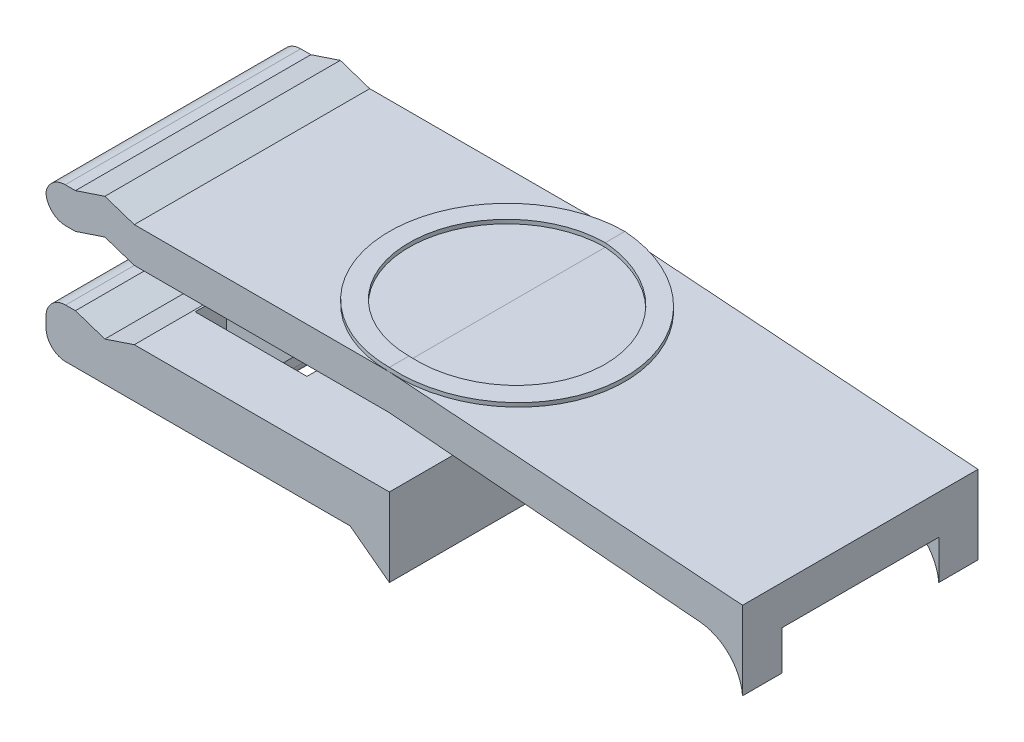
from build123d import *

# Parameters (mm, degrees)
BOSS_EXTRUDE1_DEPTH   = 12
BOSS_EXTRUDE1_2_DEPTH = 12
SKETCH2_W             = 5.7
SKETCH2_H             = 6
CUT_EXTRUDE1_DEPTH    = 3
BOSS_EXTRUDE2_DEPTH   = 6
BOSS_EXTRUDE3_START   = -6
BOSS_EXTRUDE3_DEPTH   = 2.5
FILLET7_R             = 1
FILLET8_R             = 1
FILLET10_R            = 1
FILLET11_R            = 1
BOSS_EXTRUDE4_DEPTH   = 2
BOSS_EXTRUDE5_START   = -10
BOSS_EXTRUDE5_DEPTH   = 2
FILLET12_R            = 0.5
BOSS_EXTRUDE7_REACH   = 45.42
BOSS_EXTRUDE7_START   = 5.5
SKETCH6_R             = 6
SKETCH6_R_2           = 5
CUT_EXTRUDE3_DEPTH    = 38.919520039


with BuildPart() as part:
    # Sketch1 → Boss-Extrude1 (new body)
    with BuildSketch(Plane.XY):
        Polygon((0, 4), (-18, 5.3), (-31, 5.3), (-32.5, 5.8), (-34, 5.3), (-35.5, 5.3), (-35.5, 3.5), (-34, 3.5), (-32.5, 4), (-31, 3.5), (-18, 3.5), (0, 2), align=None)
    extrude(amount=BOSS_EXTRUDE1_DEPTH)

    # Sketch4 → Boss-Extrude3 (add, symmetric)
    with BuildSketch(Plane.XY.offset(12).offset(BOSS_EXTRUDE3_START)):
        with BuildLine():
            Line((-28.4, -2), (-26.4, 0))
            Line((-26.4, 0), (-26.4, 0.4))
            Line((-26.4, 0.4), (-27.9, 0.4))
            Line((-27.9, 0.4), (-27.9, 1.9))
            ThreePointArc((-27.9, 1.9), (-27.43137085, 3.03137085), (-26.3, 3.5))
            Line((-26.3, 3.5), (-29.8, 3.5))
            Line((-29.8, 3.5), (-29.8, -3))
            Line((-29.8, -3), (-28.4, -3))
            Line((-28.4, -3), (-28.4, -2))
        make_face()
    extrude(amount=BOSS_EXTRUDE3_DEPTH, both=True)

    # Fillet8
    fillet8_edges = [part.edges().sort_by_distance(p)[0] for p in [
        (-35.5, 3.5, 6),
    ]]
    fillet(fillet8_edges, radius=FILLET8_R)

    # Fillet10
    # the kernel refuses this fillet: 1 mm, written as the material it takes off along each edge
    with BuildSketch(Plane(origin=(-35.5, 5.3, -2.449489743), x_dir=(1.545430450277731e-12, -1.0, 0), z_dir=(0, 0, 1))) as fillet10_piece_1:
        with BuildLine():
            CenterArc((1, 0.979795897), FILLET10_R, 180, 78.463040967)
            Line((0, 0.979795897), (-0.02, 0.979795897))
            Line((-0.02, 0.979795897), (-0.02, 0))
            Line((-0.02, 0), (0, -0.02))
            ThreePointArc((0, -0.02), (0.4, -0.02), (0.796, -0.019595918))
            Line((0.796, -0.019595918), (0.8, 0))
        make_face()
    extrude(amount=16.898979486, mode=Mode.SUBTRACT)

    # Sketch5 → Boss-Extrude4 (add)
    with BuildSketch(Plane.XY.offset(12)):
        with BuildLine():
            Line((0, 2), (0, 0))
            ThreePointArc((0, 0), (-0.691300526, 1.490517656), (-2.181818182, 2.181818182))
            Line((-2.181818182, 2.181818182), (0, 2))
        make_face()
    extrude(amount=-BOSS_EXTRUDE4_DEPTH)

    # Sketch5<2> → Boss-Extrude5 (add)
    with BuildSketch(Plane.XY.offset(12).offset(BOSS_EXTRUDE5_START)):
        with BuildLine():
            Line((0, 2), (0, 0))
            ThreePointArc((0, 0), (-0.691300526, 1.490517656), (-2.181818182, 2.181818182))
            Line((-2.181818182, 2.181818182), (0, 2))
        make_face()
    extrude(amount=-BOSS_EXTRUDE5_DEPTH)

    # Fillet12
    fillet12_edges = [part.edges().sort_by_distance(p)[0] for p in [
        (-28.4, -3, 6),
        (-29.8, -3, 6),
    ]]
    fillet(fillet12_edges, radius=FILLET12_R)

    # Sketch6 → Boss-Extrude7 (add, up to next)
    with BuildSketch(Plane(origin=(0, 0, 0), x_dir=(1, 0, 0), z_dir=(0, 1, 0)).offset(BOSS_EXTRUDE7_START), mode=Mode.PRIVATE) as boss_extrude7_sk1:
        with Locations(Location((-18, -6, 0), (0, 0, 270))):
            Circle(SKETCH6_R)
        with Locations(Location((-18, -6, 0), (0, 0, 270))):
            Circle(SKETCH6_R_2, mode=Mode.SUBTRACT)
    boss_extrude7_tool1 = extrude(boss_extrude7_sk1.sketch, amount=-BOSS_EXTRUDE7_REACH, mode=Mode.PRIVATE) - part.part
    add(boss_extrude7_tool1.solids().sort_by_distance((-18, 5.5, 0.169706))[0])

    # Sketch7 → Cut-Extrude3 (cut, through all)
    with BuildSketch(Plane.XY):
        Polygon((-18, 5.5), (-12, 5.066666667), (-12, 5.5), align=None)
    extrude(amount=CUT_EXTRUDE3_DEPTH, mode=Mode.SUBTRACT)


with BuildPart() as body_2:
    # Sketch1 → Boss-Extrude1 2 (new body)
    with BuildSketch(Plane.XY):
        Polygon((-35.5, -2.5), (-20, -2.5), (-18, -4), (-18, 0), (-31, 0), (-32.5, -0.5), (-34, 0), (-35.5, 0), align=None)
    extrude(amount=BOSS_EXTRUDE1_2_DEPTH)

    # Sketch2 → Cut-Extrude1 (cut)
    with BuildSketch(Plane.XZ.offset(2.5)):
        with Locations((-28.05, 6)):
            Rectangle(SKETCH2_W, SKETCH2_H)
    extrude(amount=-CUT_EXTRUDE1_DEPTH, mode=Mode.SUBTRACT)

    # Sketch3 → Boss-Extrude2 (add)
    with BuildSketch(Plane.XY.offset(3)):
        Polygon((-25.2, 0), (-27.2, -2), (-27.2, -2.5), (-25.2, -2.5), align=None)
    extrude(amount=BOSS_EXTRUDE2_DEPTH)

    # Fillet7
    fillet7_edges = [body_2.edges().sort_by_distance(p)[0] for p in [
        (-35.5, 0, 6),
    ]]
    fillet(fillet7_edges, radius=FILLET7_R)

    # Fillet11
    fillet11_edges = [body_2.edges().sort_by_distance(p)[0] for p in [
        (-35.5, -2.5, 6),
    ]]
    fillet(fillet11_edges, radius=FILLET11_R)


solid = Compound([part.part, body_2.part])
